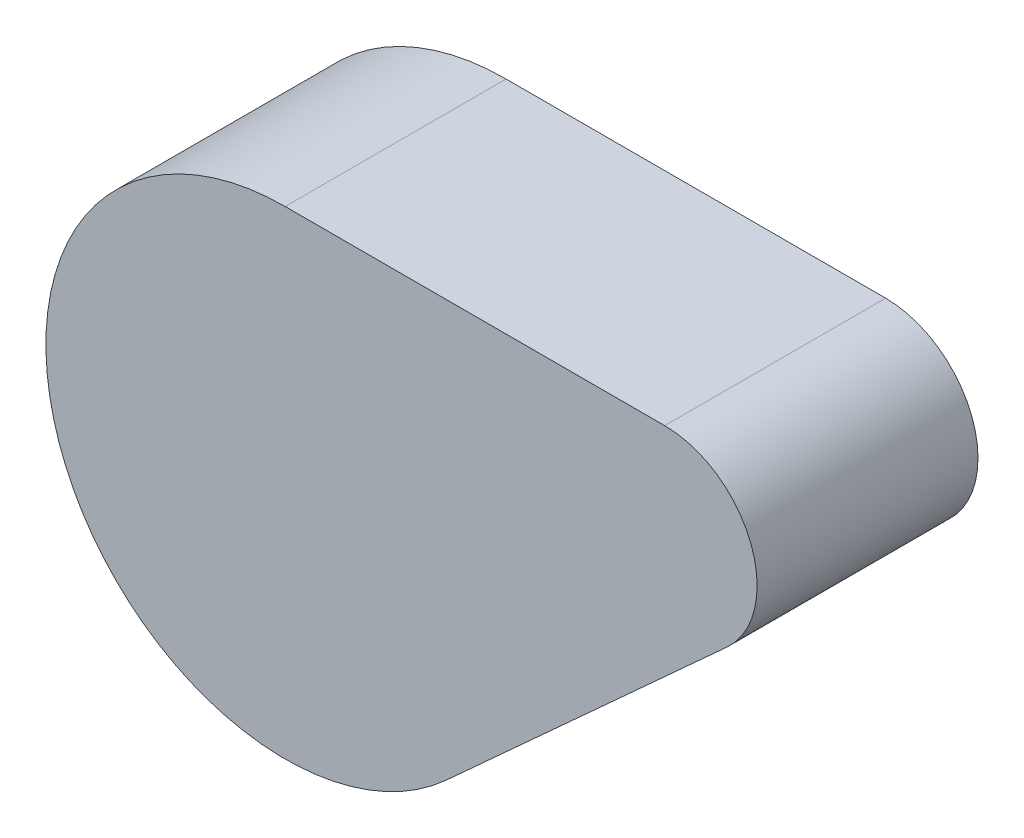
from build123d import *

# Parameters (mm, degrees)
SALIENTE_EXTRUIR1_DEPTH = 30


with BuildPart() as part:
    # Croquis1 → Saliente-Extruir1 (new body)
    with BuildSketch(Plane.XY):
        with BuildLine():
            Line((-6.65, 39.55), (44.9, 39.55))
            ThreePointArc((44.9, 39.55), (56.604099439, 31.52952054), (53.34843965, 17.719570728))
            Line((53.34843965, 17.719570728), (15.228429374, -16.982984171))
            ThreePointArc((15.228429374, -16.982984171), (-36.959420858, -4.679834066), (-6.65, 39.55))
        make_face()
    extrude(amount=SALIENTE_EXTRUIR1_DEPTH)


solid = part.part
